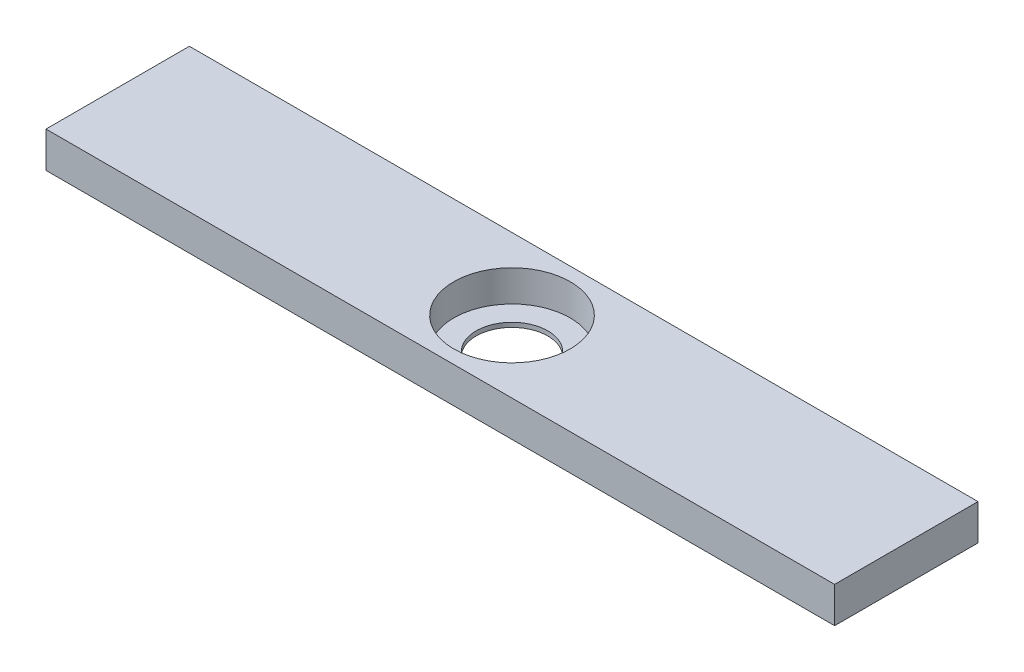
from build123d import *

# Parameters (mm, degrees)
SKETCH1_W           = 279.4
SKETCH1_H           = 50.8
BOSS_EXTRUDE1_DEPTH = 12.7
SKETCH2_R           = 20.6375
CUT_EXTRUDE1_DEPTH  = 11.1125
SKETCH3_R           = 12.7
CUT_EXTRUDE2_DEPTH  = 143.42449809


with BuildPart() as part:
    # Sketch1 → Boss-Extrude1 (new body)
    with BuildSketch(Plane(origin=(0, 0, 0), x_dir=(1, 0, 0), z_dir=(0, 1, 0))):
        Rectangle(SKETCH1_W, SKETCH1_H)
    extrude(amount=BOSS_EXTRUDE1_DEPTH)

    # Sketch2 → Cut-Extrude1 (cut)
    with BuildSketch(Plane(origin=(0, 12.7, 0), x_dir=(1, 0, 0), z_dir=(0, 1, 0))):
        Circle(SKETCH2_R)
    extrude(amount=-CUT_EXTRUDE1_DEPTH, mode=Mode.SUBTRACT)

    # Sketch3 → Cut-Extrude2 (cut, through all)
    with BuildSketch(Plane(origin=(0, 1.5875, 0), x_dir=(1, 0, 0), z_dir=(0, 1, 0))):
        Circle(SKETCH3_R)
    extrude(amount=-CUT_EXTRUDE2_DEPTH, mode=Mode.SUBTRACT)


solid = part.part
